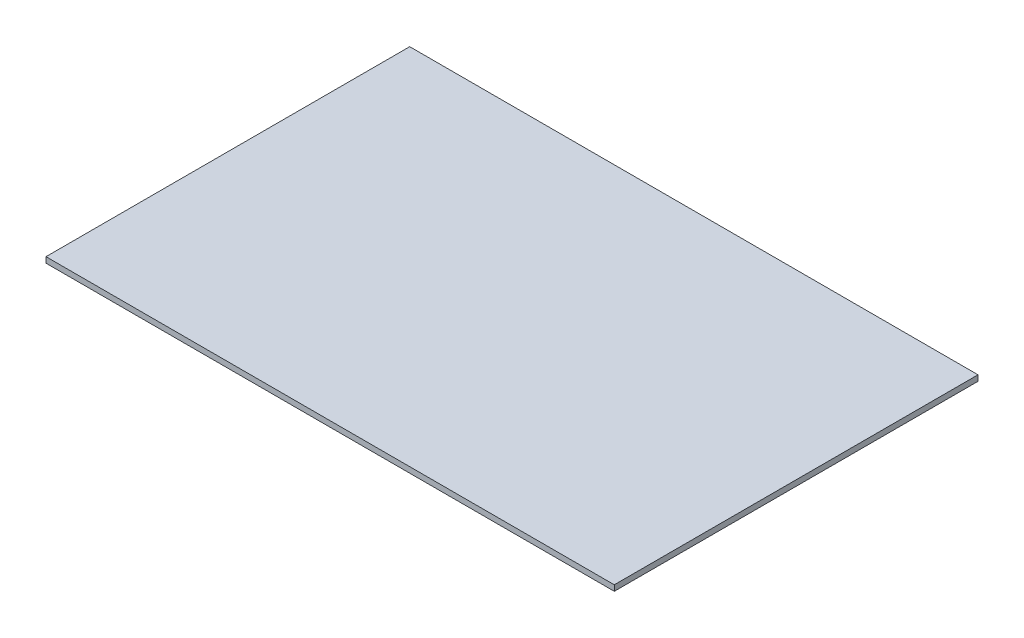
from build123d import *

# Parameters (mm, degrees)
SKETCH1_W           = 1270
SKETCH1_H           = 812.8
BOSS_EXTRUDE1_DEPTH = 12.7


with BuildPart() as part:
    # Sketch1 → Boss-Extrude1 (new body)
    with BuildSketch(Plane(origin=(0, 0, 0), x_dir=(1, 0, 0), z_dir=(0, 1, 0))):
        Rectangle(SKETCH1_W, SKETCH1_H)
    extrude(amount=BOSS_EXTRUDE1_DEPTH)


solid = part.part
